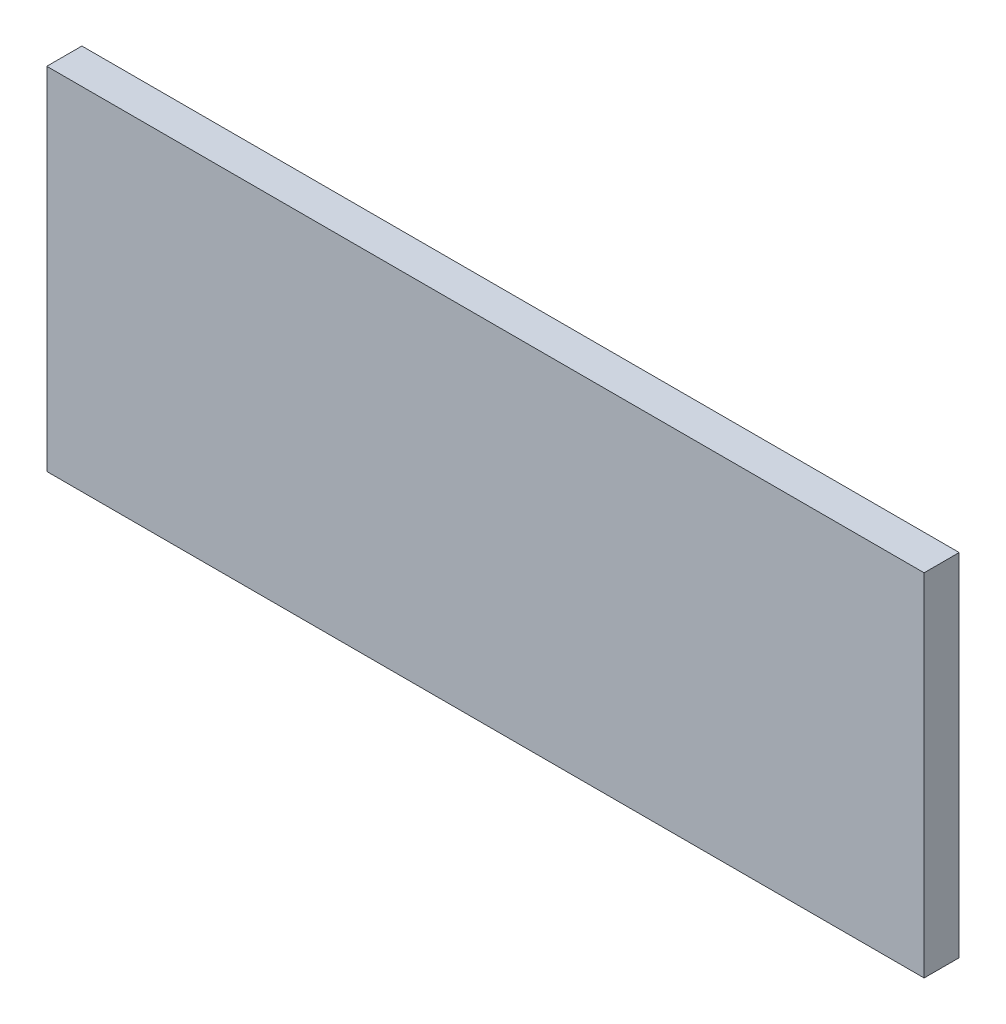
from build123d import *

# Parameters (mm, degrees)
SKETCH_1_W      = 150
SKETCH_1_H      = 60
EXTRUDE_1_DEPTH = 6


with BuildPart() as part:
    # Эскиз1 → Бобышка-Вытянуть1 (new body)
    with BuildSketch(Plane.XY):
        Rectangle(SKETCH_1_W, SKETCH_1_H)
    extrude(amount=EXTRUDE_1_DEPTH)


solid = part.part
